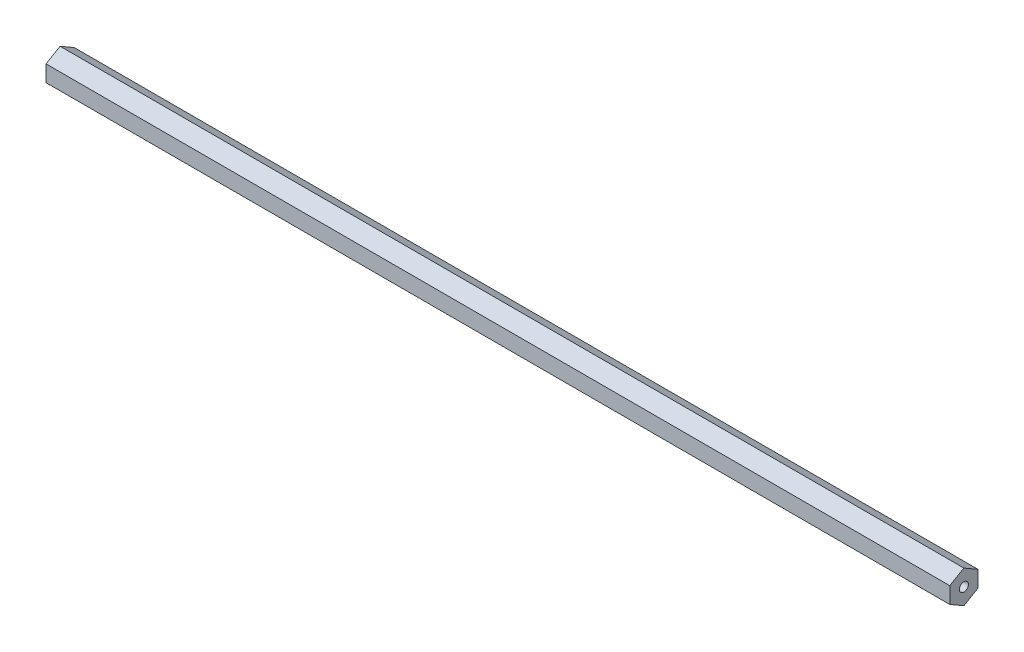
from build123d import *

# Parameters (mm, degrees)
BOSS_EXTRUDE1_DEPTH        = 203.2
F_10_32_TAPPED_HOLE1_D     = 4.0386
F_10_32_TAPPED_HOLE1_DEPTH = 12.0396
F_10_32_TAPPED_HOLE1_TIP   = 1.213317848
F_10_32_TAPPED_HOLE2_D     = 4.0386
F_10_32_TAPPED_HOLE2_DEPTH = 12.0396
F_10_32_TAPPED_HOLE2_TIP   = 1.213317848


with BuildPart() as part:
    # Sketch1 → Boss-Extrude1 (new, symmetric)
    with BuildSketch(Plane(origin=(0, 0, 0), x_dir=(0, 0, -1), z_dir=(1, 0, 0))):
        Polygon((0, 7.332348419), (-6.35, 3.666174209), (-6.35, -3.666174209), (0, -7.332348419), (6.35, -3.666174209), (6.35, 3.666174209), align=None)
    extrude(amount=BOSS_EXTRUDE1_DEPTH, both=True)

    # #10-32 Tapped Hole1
    with Locations(Plane(origin=(203.2, 0, 0), x_dir=(0, 0, -1), z_dir=(1, 0, 0))):
        with Locations((0, 0)):
            Hole(F_10_32_TAPPED_HOLE1_D / 2, depth=F_10_32_TAPPED_HOLE1_DEPTH)
            with Locations((0, 0, -(F_10_32_TAPPED_HOLE1_DEPTH + F_10_32_TAPPED_HOLE1_TIP / 2))):  # 118° drill point
                Cone(0, F_10_32_TAPPED_HOLE1_D / 2, F_10_32_TAPPED_HOLE1_TIP, mode=Mode.SUBTRACT)

    # #10-32 Tapped Hole2
    with Locations(Plane.ZY.offset(203.2)):
        with Locations((0, 0)):
            Hole(F_10_32_TAPPED_HOLE2_D / 2, depth=F_10_32_TAPPED_HOLE2_DEPTH)
            with Locations((0, 0, -(F_10_32_TAPPED_HOLE2_DEPTH + F_10_32_TAPPED_HOLE2_TIP / 2))):  # 118° drill point
                Cone(0, F_10_32_TAPPED_HOLE2_D / 2, F_10_32_TAPPED_HOLE2_TIP, mode=Mode.SUBTRACT)


solid = part.part
